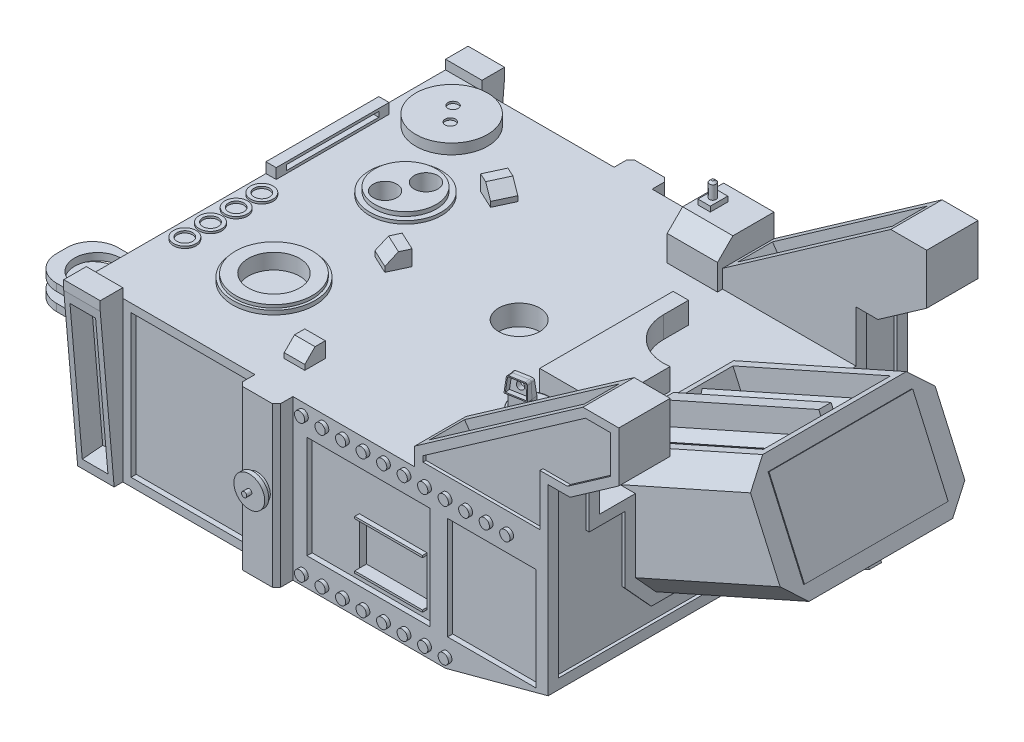
from build123d import *

# Parameters (mm, degrees)
SKETCH1_W                        = 450
SKETCH1_H                        = 155
BOSS_EXTRUDE1_DEPTH              = 175
SKETCH2_W                        = 35.55
SKETCH2_H                        = 164
BOSS_EXTRUDE2_DEPTH              = 22
SKETCH3_W                        = 37
SKETCH3_H                        = 155
BOSS_EXTRUDE3_DEPTH              = 16
CUT_EXTRUDE1_DEPTH               = 425.979117134
CUT_EXTRUDE2_DEPTH               = 35.55
CHAMFER1_SIZE                    = 4
SKETCH6_R                        = 12.5
BOSS_EXTRUDE4_DEPTH              = 4
SKETCH7_R                        = 15
BOSS_EXTRUDE5_DEPTH              = 4
SKETCH8_R                        = 2.5
BOSS_EXTRUDE6_DEPTH              = 5
SKETCH9_W                        = 120
SKETCH9_H                        = 100
SKETCH9_W_2                      = 112.725
SKETCH9_H_2                      = 139
SKETCH9_W_3                      = 86
CUT_EXTRUDE3_DEPTH               = 5
SKETCH10_W                       = 66
SKETCH10_H                       = 44
CUT_EXTRUDE4_DEPTH               = 7
SKETCH12_W                       = 66
SKETCH12_H                       = 2
BOSS_EXTRUDE7_DEPTH              = 4.5
SKETCH13_W                       = 25
SKETCH13_H                       = 138
CUT_EXTRUDE5_DEPTH               = 20
CHAMFER1_OF_MIRROR1_SIZE         = 4
SKETCH14_W                       = 105
SKETCH14_H                       = 120
CUT_EXTRUDE6_DEPTH               = 15
SKETCH15_R                       = 7.5
BOSS_EXTRUDE8_DEPTH              = 15
SKETCH16_R                       = 48.5
BOSS_EXTRUDE9_DEPTH              = 10
SKETCH17_R                       = 35
BOSS_EXTRUDE11_DEPTH             = 5
SKETCH18_W                       = 60
SKETCH18_H                       = 7
BOSS_EXTRUDE12_DEPTH             = 85
FILLET4_R                        = 25
SKETCH19_R                       = 22.5
CUT_EXTRUDE7_DEPTH               = 85
SKETCH20_W                       = 10
SKETCH20_H                       = 110
BOSS_EXTRUDE13_DEPTH             = 10
SKETCH21_W                       = 90
SKETCH21_H                       = 5
CUT_EXTRUDE8_DEPTH               = 10
SKETCH22_W                       = 95
SKETCH22_H                       = 32
CUT_EXTRUDE9_DEPTH               = 5
SKETCH23_R                       = 20
CUT_EXTRUDE10_DEPTH              = 20
BOSS_EXTRUDE14_DEPTH             = 90
CHAMFER3_SIZE                    = 20
SKETCH25_W                       = 168.155027328
SKETCH25_H                       = 124
CUT_EXTRUDE11_DEPTH              = 111
SKETCH26_R                       = 32.5
BOSS_EXTRUDE15_DEPTH             = 168.155027328
SKETCH27_W                       = 168.155027328
SKETCH27_H                       = 12
BOSS_EXTRUDE17_DEPTH             = 5
BOSS_EXTRUDE17_DIRECTION_2_REACH = 454.768
CIRPATTERN1_COUNT                = 10
SKETCH28_W                       = 140
SKETCH28_H                       = 85
BOSS_EXTRUDE18_DEPTH             = 1
SKETCH29_R                       = 5
BOSS_EXTRUDE19_DEPTH             = 3.5
SKETCH30_R                       = 5.5
BOSS_EXTRUDE20_DEPTH             = 2.5
BOSS_EXTRUDE21_DEPTH             = 50
SKETCH32_W                       = 184
SKETCH32_H                       = 34
CUT_EXTRUDE12_DEPTH              = 25
CUT_EXTRUDE13_DEPTH              = 3
CUT_EXTRUDE14_DEPTH              = 3
SKETCH35_R                       = 35
BOSS_EXTRUDE22_DEPTH             = 10
SKETCH36_R                       = 5
CUT_EXTRUDE15_DEPTH              = 2
SKETCH37_W                       = 49
SKETCH37_H                       = 55
BOSS_EXTRUDE23_DEPTH             = 40
CHAMFER4_SIZE                    = 15
SKETCH38_W                       = 12
SKETCH38_H                       = 17
BOSS_EXTRUDE24_DEPTH             = 5
SKETCH39_R                       = 3.25
BOSS_EXTRUDE25_DEPTH             = 15
CHAMFER5_SIZE                    = 2
BOSS_EXTRUDE26_DEPTH             = 21
SKETCH42_R                       = 20
BOSS_EXTRUDE27_DEPTH             = 3
BOSS_EXTRUDE28_DEPTH             = 6
CUT_EXTRUDE17_DEPTH              = 4
SKETCH45_R                       = 12.5
BOSS_EXTRUDE29_DEPTH             = 20
SKETCH46_R                       = 18
BOSS_EXTRUDE30_DEPTH             = 5
BOSS_EXTRUDE31_DEPTH             = 15
BOSS_EXTRUDE32_DEPTH             = 15
BOSS_EXTRUDE32_TAPER             = 5
SKETCH49_R                       = 3.5
CUT_EXTRUDE18_DEPTH              = 15
CHAMFER6_SIZE                    = 2
FILLET5_R                        = 2
FILLET6_R                        = 2
BOSS_EXTRUDE33_DEPTH             = 5
SKETCH51_R                       = 11
SKETCH51_R_2                     = 7.5
BOSS_EXTRUDE34_DEPTH             = 2
LPATTERN1_COUNT                  = 4
LPATTERN1_PITCH                  = 25
SKETCH52_R                       = 35
BOSS_EXTRUDE35_DEPTH             = 3
SKETCH53_R                       = 30
BOSS_EXTRUDE36_DEPTH             = 4
CUT_EXTRUDE21_START              = -13
SKETCH54_R                       = 11.5
CUT_EXTRUDE21_DEPTH              = 20
BOSS_EXTRUDE37_DEPTH             = 15
CHAMFER7_SIZE                    = 10
SKETCH56_R                       = 4
CUT_EXTRUDE22_DEPTH              = 2
SKETCH57_R                       = 4
CUT_EXTRUDE23_DEPTH              = 2
SKETCH58_R                       = 40
BOSS_EXTRUDE38_DEPTH             = 4
SKETCH59_R                       = 37.5
BOSS_EXTRUDE39_DEPTH             = 3
SKETCH60_R                       = 25
CUT_EXTRUDE24_DEPTH              = 15
SKETCH61_W                       = 20
SKETCH61_H                       = 20
BOSS_EXTRUDE40_DEPTH             = 15
CHAMFER8_SIZE                    = 10
SKETCH62_R                       = 5
CUT_EXTRUDE25_DEPTH              = 10


with BuildPart() as part:
    # Sketch1 → Boss-Extrude1 (new, symmetric)
    with BuildSketch(Plane.XY):
        Rectangle(SKETCH1_W, SKETCH1_H)
    extrude(amount=BOSS_EXTRUDE1_DEPTH, both=True)

    # Sketch2 → Boss-Extrude2 (add)
    with BuildSketch(Plane.XY.offset(175)):
        with Locations((-207.225, 4.5)):
            Rectangle(SKETCH2_W, SKETCH2_H)
    boss_extrude2 = extrude(amount=BOSS_EXTRUDE2_DEPTH)

    # Sketch3 → Boss-Extrude3 (add)
    with BuildSketch(Plane.XY.offset(175)):
        with Locations((-42.225, 0)):
            Rectangle(SKETCH3_W, SKETCH3_H)
    boss_extrude3 = extrude(amount=BOSS_EXTRUDE3_DEPTH)

    # Sketch4 → Cut-Extrude1 (cut, through all)
    with BuildSketch(Plane.XY.offset(175)):
        Polygon((125, -77.5), (225, -50.705080757), (225, -77.5), align=None)
    extrude(amount=-CUT_EXTRUDE1_DEPTH, mode=Mode.SUBTRACT)

    # Sketch5 → Cut-Extrude2 (cut)
    with BuildSketch(Plane.ZY.offset(225)):
        Polygon((197, 77.5), (183.439257153, -77.5), (197, -77.5), align=None)
    cut_extrude2 = extrude(amount=-CUT_EXTRUDE2_DEPTH, mode=Mode.SUBTRACT)

    # Chamfer1
    chamfer1_edges = [part.edges().sort_by_distance(p)[0] for p in [
        (-60.725, 0, 191),
        (-23.725, 0, 191),
    ]]
    chamfer(chamfer1_edges, length=CHAMFER1_SIZE)

    # Sketch6 → Boss-Extrude4 (add)
    with BuildSketch(Plane.XY.offset(191)):
        with Locations((-42.225, 0)):
            Circle(SKETCH6_R)
    boss_extrude4 = extrude(amount=BOSS_EXTRUDE4_DEPTH)

    # Sketch7 → Boss-Extrude5 (add)
    with BuildSketch(Plane.XY.offset(195)):
        with Locations((-42.225, 0)):
            Circle(SKETCH7_R)
    boss_extrude5 = extrude(amount=BOSS_EXTRUDE5_DEPTH)

    # Sketch8 → Boss-Extrude6 (add)
    with BuildSketch(Plane.XY.offset(199)):
        with Locations((-42.225, 0)):
            Circle(SKETCH8_R)
    boss_extrude6 = extrude(amount=BOSS_EXTRUDE6_DEPTH)

    # Sketch9 → Cut-Extrude3 (cut)
    with BuildSketch(Plane.XY.offset(175)):
        with Locations((50, 0)):
            Rectangle(SKETCH9_W, SKETCH9_H)
        with Locations((-125.0875, 0)):
            Rectangle(SKETCH9_W_2, SKETCH9_H_2)
        with Locations((170, 0)):
            Rectangle(SKETCH9_W_3, SKETCH9_H)
    cut_extrude3 = extrude(amount=-CUT_EXTRUDE3_DEPTH, mode=Mode.SUBTRACT)

    # Sketch10 → Cut-Extrude4 (cut)
    with BuildSketch(Plane.XY.offset(170)):
        with Locations((69, -18)):
            Rectangle(SKETCH10_W, SKETCH10_H)
    cut_extrude4 = extrude(amount=-CUT_EXTRUDE4_DEPTH, mode=Mode.SUBTRACT)

    # Sketch12 → Boss-Extrude7 (add)
    with BuildSketch(Plane.XY.offset(170)):
        with Locations((69, 5)):
            Rectangle(SKETCH12_W, SKETCH12_H)
        with Locations((69, -41)):
            Rectangle(SKETCH12_W, SKETCH12_H)
    boss_extrude7 = extrude(amount=BOSS_EXTRUDE7_DEPTH)

    # Sketch13 → Cut-Extrude5 (cut)
    with BuildSketch(Plane(origin=(0, -16.515645929, 188.774696787), x_dir=(1, 0, 0), z_dir=(0, -0.08715574274765135, 0.9961946980917462))):
        with Locations((-207.225, 16.578733014)):
            Rectangle(SKETCH13_W, SKETCH13_H)
    cut_extrude5 = extrude(amount=-CUT_EXTRUDE5_DEPTH, mode=Mode.SUBTRACT)

    # Mirror1: Boss-Extrude2, Boss-Extrude3, Cut-Extrude2, Boss-Extrude4, Boss-Extrude5, Boss-Extrude6, Cut-Extrude3, Cut-Extrude4, Boss-Extrude7, Cut-Extrude5 across plane
    add(boss_extrude2.mirror(Plane.XY))
    add(boss_extrude3.mirror(Plane.XY))
    add(cut_extrude2.mirror(Plane.XY), mode=Mode.SUBTRACT)
    add(boss_extrude4.mirror(Plane.XY))
    add(boss_extrude5.mirror(Plane.XY))
    add(boss_extrude6.mirror(Plane.XY))
    add(cut_extrude3.mirror(Plane.XY), mode=Mode.SUBTRACT)
    add(cut_extrude4.mirror(Plane.XY), mode=Mode.SUBTRACT)
    add(boss_extrude7.mirror(Plane.XY))
    add(cut_extrude5.mirror(Plane.XY), mode=Mode.SUBTRACT)

    # Chamfer1 of Mirror1
    chamfer1_of_mirror1_edges = [part.edges().sort_by_distance(p)[0] for p in [
        (-60.725, 0, -191),
        (-23.725, 0, -191),
    ]]
    chamfer(chamfer1_of_mirror1_edges, length=CHAMFER1_OF_MIRROR1_SIZE)

    # Sketch14 → Cut-Extrude6 (cut)
    with BuildSketch(Plane.ZY.offset(225)):
        with Locations((-117.5, 0)):
            Rectangle(SKETCH14_W, SKETCH14_H)
    extrude(amount=-CUT_EXTRUDE6_DEPTH, mode=Mode.SUBTRACT)

    # Sketch15 → Boss-Extrude8 (add)
    with BuildSketch(Plane.ZY.offset(210)):
        with Locations(Location((-143, -5, 0), (0, 0, 180))):
            Circle(SKETCH15_R)
    extrude(amount=BOSS_EXTRUDE8_DEPTH)

    # Sketch16 → Boss-Extrude9 (add)
    with BuildSketch(Plane.ZY.offset(225)):
        with Locations(Location((99, 0, 0), (0, 0, 90))):
            Circle(SKETCH16_R)
    extrude(amount=BOSS_EXTRUDE9_DEPTH)

    # Sketch17 → Boss-Extrude11 (add)
    with BuildSketch(Plane.ZY.offset(235)):
        with Locations(Location((99, 0, 0), (0, 0, 270))):
            Circle(SKETCH17_R)
    extrude(amount=BOSS_EXTRUDE11_DEPTH)

    # Sketch18 → Boss-Extrude12 (add)
    with BuildSketch(Plane.ZY.offset(240)):
        with Locations((99, 8.5)):
            Rectangle(SKETCH18_W, SKETCH18_H)
        with Locations((99, -8.5)):
            Rectangle(SKETCH18_W, SKETCH18_H)
    extrude(amount=BOSS_EXTRUDE12_DEPTH)

    # Fillet4
    fillet4_edges = [part.edges().sort_by_distance(p)[0] for p in [
        (-325, 8.5, 69),
        (-325, 8.5, 129),
        (-325, -8.5, 129),
        (-325, -8.5, 69),
    ]]
    fillet(fillet4_edges, radius=FILLET4_R)

    # Sketch19 → Cut-Extrude7 (cut)
    with BuildSketch(Plane.XZ.offset(12)):
        with Locations((-290, 99)):
            Circle(SKETCH19_R)
    extrude(amount=-CUT_EXTRUDE7_DEPTH, mode=Mode.SUBTRACT)

    # Sketch20 → Boss-Extrude13 (add)
    with BuildSketch(Plane(origin=(0, 77.5, 0), x_dir=(1, 0, 0), z_dir=(0, 1, 0))):
        with Locations((-220, 55)):
            Rectangle(SKETCH20_W, SKETCH20_H)
    extrude(amount=BOSS_EXTRUDE13_DEPTH)

    # Sketch21 → Cut-Extrude8 (cut)
    with BuildSketch(Plane.ZY.offset(225)):
        with Locations((-55, 82.5)):
            Rectangle(SKETCH21_W, SKETCH21_H)
    extrude(amount=-CUT_EXTRUDE8_DEPTH, mode=Mode.SUBTRACT)

    # Sketch22 → Cut-Extrude9 (cut)
    with BuildSketch(Plane.ZY.offset(225)):
        with Locations((0, -15.1)):
            Rectangle(SKETCH22_W, SKETCH22_H)
    extrude(amount=-CUT_EXTRUDE9_DEPTH, mode=Mode.SUBTRACT)

    # Sketch23 → Cut-Extrude10 (cut)
    with BuildSketch(Plane(origin=(0, 77.5, 0), x_dir=(1, 0, 0), z_dir=(0, 1, 0))):
        with Locations(Location((21.775, 0, 0), (0, 0, 180))):
            Circle(SKETCH23_R)
    extrude(amount=-CUT_EXTRUDE10_DEPTH, mode=Mode.SUBTRACT)

    # Sketch24 → Boss-Extrude14 (add, symmetric)
    with BuildSketch(Plane.XY):
        Polygon((99, 50), (144.147767381, -51.403545798), (374.147767381, 50.999051823), (329, 152.402597621), align=None)
    extrude(amount=BOSS_EXTRUDE14_DEPTH, both=True)

    # Chamfer3
    chamfer3_edges = [part.edges().sort_by_distance(p)[0] for p in [
        (244.883005641, 114.95129881, -90),
        (299.573883691, 17.796619629, -90),
        (299.573883691, 17.796619629, 90),
        (244.883005641, 114.95129881, 90),
    ]]
    chamfer(chamfer3_edges, length=CHAMFER3_SIZE)

    # Sketch25 → Cut-Extrude11 (cut)
    with BuildSketch(Plane(origin=(-2.200585652, 4.942596298, 0), x_dir=(0.9135454576426033, 0.4067366430757949, 0), z_dir=(-0.4067366430757949, 0.9135454576426033, 0))):
        with Locations((270.466662853, 0)):
            Rectangle(SKETCH25_W, SKETCH25_H)
    extrude(amount=-CUT_EXTRUDE11_DEPTH, mode=Mode.SUBTRACT)

    # Sketch26 → Boss-Extrude15 (add)
    with BuildSketch(Plane(origin=(170.274960595, 75.811296847, 0), x_dir=(0, 0, -1), z_dir=(0.9135454576426033, 0.4067366430757949, 0))):
        with Locations(Location((0, -50.089654782, 0), (0, 0, 270))):
            Circle(SKETCH26_R)
    extrude(amount=BOSS_EXTRUDE15_DEPTH)

    # Sketch27 → Boss-Extrude17 (add)
    with BuildSketch(Plane(origin=(-2.200585652, 4.942596298, 0), x_dir=(0.9135454576426033, 0.4067366430757949, 0), z_dir=(-0.4067366430757949, 0.9135454576426033, 0))):
        with Locations((270.466662853, 0)):
            Rectangle(SKETCH27_W, SKETCH27_H)
    boss_extrude17 = extrude(amount=BOSS_EXTRUDE17_DEPTH)

    # Sketch27 → Boss-Extrude17 direction 2 (add, up to next)
    with BuildSketch(Plane(origin=(-2.200585652, 4.942596298, 0), x_dir=(0.9135454576426033, 0.4067366430757949, 0), z_dir=(-0.4067366430757949, 0.9135454576426033, 0)), mode=Mode.PRIVATE) as boss_extrude17_direction_2_sk1:
        with Locations((270.466662853, 0)):
            Rectangle(SKETCH27_W, SKETCH27_H)
    boss_extrude17_direction_2_tool1 = extrude(boss_extrude17_direction_2_sk1.sketch, amount=-BOSS_EXTRUDE17_DIRECTION_2_REACH, mode=Mode.PRIVATE) - part.part
    boss_extrude17_direction_2 = boss_extrude17_direction_2_tool1.solids().sort_by_distance((244.883006, 114.951299, 0))[0]
    add(boss_extrude17_direction_2)

    # CirPattern1: Boss-Extrude17, Boss-Extrude17 direction 2 ×10 about axis
    cirpattern1_axis = Axis((20.373298039, -45.759176601, 0), (0.9135454576426033, 0.40673664307579477, 0))
    add([boss_extrude17.rotate(cirpattern1_axis, i * 360 / CIRPATTERN1_COUNT) for i in range(1, CIRPATTERN1_COUNT)])
    add([boss_extrude17_direction_2.rotate(cirpattern1_axis, i * 360 / CIRPATTERN1_COUNT) for i in range(1, CIRPATTERN1_COUNT)])

    # Sketch28 → Boss-Extrude18 (add)
    with BuildSketch(Plane(origin=(331.200585652, 147.460001323, 0), x_dir=(0, 0, -1), z_dir=(0.9135454576426035, 0.4067366430757945, 0))):
        with Locations((0, -50.089654782)):
            Rectangle(SKETCH28_W, SKETCH28_H)
    extrude(amount=BOSS_EXTRUDE18_DEPTH)

    # Sketch29 → Boss-Extrude19 (add)
    with BuildSketch(Plane.XY.offset(175)):
        with Locations(Location((-13.725, 67, 0), (0, 0, 180))):
            Circle(SKETCH29_R)
        with Locations(Location((6.275, 67, 0), (0, 0, 180))):
            Circle(SKETCH29_R)
        with Locations(Location((26.275, 67, 0), (0, 0, 180))):
            Circle(SKETCH29_R)
        with Locations(Location((46.275, 67, 0), (0, 0, 180))):
            Circle(SKETCH29_R)
        with Locations(Location((66.275, 67, 0), (0, 0, 180))):
            Circle(SKETCH29_R)
        with Locations(Location((86.275, 67, 0), (0, 0, 180))):
            Circle(SKETCH29_R)
        with Locations(Location((106.275, 67, 0), (0, 0, 180))):
            Circle(SKETCH29_R)
        with Locations(Location((126.275, 67, 0), (0, 0, 180))):
            Circle(SKETCH29_R)
        with Locations(Location((146.275, 67, 0), (0, 0, 180))):
            Circle(SKETCH29_R)
        with Locations(Location((166.275, 67, 0), (0, 0, 180))):
            Circle(SKETCH29_R)
        with Locations(Location((186.275, 67, 0), (0, 0, 180))):
            Circle(SKETCH29_R)
        with Locations(Location((-13.725, -67, 0), (0, 0, 180))):
            Circle(SKETCH29_R)
        with Locations(Location((6.275, -67, 0), (0, 0, 180))):
            Circle(SKETCH29_R)
        with Locations(Location((26.275, -67, 0), (0, 0, 180))):
            Circle(SKETCH29_R)
        with Locations(Location((46.275, -67, 0), (0, 0, 180))):
            Circle(SKETCH29_R)
        with Locations(Location((66.275, -67, 0), (0, 0, 180))):
            Circle(SKETCH29_R)
        with Locations(Location((86.275, -67, 0), (0, 0, 180))):
            Circle(SKETCH29_R)
        with Locations(Location((106.275, -67, 0), (0, 0, 180))):
            Circle(SKETCH29_R)
        with Locations(Location((126.275, -67, 0), (0, 0, 180))):
            Circle(SKETCH29_R)
    boss_extrude19 = extrude(amount=BOSS_EXTRUDE19_DEPTH)

    # Mirror2: Boss-Extrude19 across plane
    add(boss_extrude19.mirror(Plane.XY))

    # Sketch30 → Boss-Extrude20 (add)
    with BuildSketch(Plane.ZY.offset(225)):
        with Locations(Location((175.4, 62.5, 0), (0, 0, 90))):
            Circle(SKETCH30_R)
        with Locations(Location((157.4, 62.5, 0), (0, 0, 90))):
            Circle(SKETCH30_R)
        with Locations(Location((139.4, 62.5, 0), (0, 0, 90))):
            Circle(SKETCH30_R)
        with Locations(Location((121.4, 62.5, 0), (0, 0, 90))):
            Circle(SKETCH30_R)
        with Locations(Location((103.4, 62.5, 0), (0, 0, 90))):
            Circle(SKETCH30_R)
        with Locations(Location((85.4, 62.5, 0), (0, 0, 90))):
            Circle(SKETCH30_R)
        with Locations(Location((67.4, 62.5, 0), (0, 0, 90))):
            Circle(SKETCH30_R)
        with Locations(Location((49.4, 62.5, 0), (0, 0, 90))):
            Circle(SKETCH30_R)
        with Locations(Location((31.4, 62.5, 0), (0, 0, 90))):
            Circle(SKETCH30_R)
        with Locations(Location((13.4, 62.5, 0), (0, 0, 90))):
            Circle(SKETCH30_R)
        with Locations(Location((-4.6, 62.5, 0), (0, 0, 90))):
            Circle(SKETCH30_R)
        with Locations(Location((-22.6, 62.5, 0), (0, 0, 90))):
            Circle(SKETCH30_R)
        with Locations(Location((-40.6, 62.5, 0), (0, 0, 90))):
            Circle(SKETCH30_R)
    extrude(amount=BOSS_EXTRUDE20_DEPTH)

    # Sketch31 → Boss-Extrude21 (add)
    with BuildSketch(Plane.XY.offset(175)):
        Polygon((225, 77.5), (95, 77.5), (95, 95.052146038), (258.830408858, 209.767433308), (293.830408858, 209.767433308), (293.830408858, 160.767433308), (246.319590289, 127.5), (225, 127.5), align=None)
    boss_extrude21 = extrude(amount=-BOSS_EXTRUDE21_DEPTH)

    # Sketch32 → Cut-Extrude12 (cut)
    with BuildSketch(Plane(origin=(-13.405856919, 19.145547837, 0), x_dir=(0.819152044288991, 0.5735764363510472, 0), z_dir=(-0.5735764363510472, 0.819152044288991, 0))):
        with Locations((232.3391154, -150)):
            Rectangle(SKETCH32_W, SKETCH32_H)
    cut_extrude12 = extrude(amount=-CUT_EXTRUDE12_DEPTH, mode=Mode.SUBTRACT)

    # Sketch33 → Cut-Extrude13 (cut)
    with BuildSketch(Plane.XY.offset(175)):
        Polygon((103, 90.887609634), (261.352799169, 201.767433308), (285.830408858, 201.767433308), (285.830408858, 164.931969713), (243.797199978, 135.5), (217, 135.5), (217, 85.5), (103, 85.5), align=None)
    cut_extrude13 = extrude(amount=-CUT_EXTRUDE13_DEPTH, mode=Mode.SUBTRACT)

    # Mirror3: Boss-Extrude21, Cut-Extrude12, Cut-Extrude13 across plane
    add(boss_extrude21.mirror(Plane.XY))
    add(cut_extrude12.mirror(Plane.XY), mode=Mode.SUBTRACT)
    add(cut_extrude13.mirror(Plane.XY), mode=Mode.SUBTRACT)

    # Sketch34 → Cut-Extrude14 (cut)
    with BuildSketch(Plane(origin=(225, 0, 0), x_dir=(0, 0, -1), z_dir=(1, 0, 0))):
        Polygon((16, -30.878993958), (-16, -30.878993958), (-16, -25.405812565), (-62, -25.405812565), (-74.409158017, -25.405812565), (-100, 2.606851466), (-100, 67.5), (-135, 67.5), (-135, 117.5), (-165, 117.5), (-165, -40.705080757), (165, -40.705080757), (165, 117.5), (135, 117.5), (135, 67.5), (100, 67.5), (100, 2.606851466), (74.409158017, -25.405812565), (62, -25.405812565), (16, -25.405812565), align=None)
    extrude(amount=-CUT_EXTRUDE14_DEPTH, mode=Mode.SUBTRACT)

    # Sketch35 → Boss-Extrude22 (add)
    with BuildSketch(Plane(origin=(0, 77.5, 0), x_dir=(1, 0, 0), z_dir=(0, 1, 0))):
        with Locations((-175, 131)):
            Circle(SKETCH35_R)
    extrude(amount=BOSS_EXTRUDE22_DEPTH)

    # Sketch36 → Cut-Extrude15 (cut)
    with BuildSketch(Plane(origin=(0, 87.5, 0), x_dir=(1, 0, 0), z_dir=(0, 1, 0))):
        with Locations(Location((-181.33, 138.66, 0), (0, 0, 180))):
            Circle(SKETCH36_R)
        with Locations(Location((-168.67, 123.34, 0), (0, 0, 180))):
            Circle(SKETCH36_R)
    extrude(amount=-CUT_EXTRUDE15_DEPTH, mode=Mode.SUBTRACT)

    # Sketch37 → Boss-Extrude23 (add)
    with BuildSketch(Plane(origin=(0, 77.5, 0), x_dir=(1, 0, 0), z_dir=(0, 1, 0))):
        with Locations((70.5, 147.5)):
            Rectangle(SKETCH37_W, SKETCH37_H)
    extrude(amount=BOSS_EXTRUDE23_DEPTH)

    # Chamfer4
    chamfer4_edges = [part.edges().sort_by_distance(p)[0] for p in [
        (70.5, 117.5, -120),
    ]]
    chamfer(chamfer4_edges, length=CHAMFER4_SIZE)

    # Sketch38 → Boss-Extrude24 (add)
    with BuildSketch(Plane(origin=(0, 117.5, 0), x_dir=(1, 0, 0), z_dir=(0, 1, 0))):
        with Locations((58, 152.5)):
            Rectangle(SKETCH38_W, SKETCH38_H)
    extrude(amount=BOSS_EXTRUDE24_DEPTH)

    # Sketch39 → Boss-Extrude25 (add)
    with BuildSketch(Plane(origin=(0, 122.5, 0), x_dir=(1, 0, 0), z_dir=(0, 1, 0))):
        with Locations(Location((58, 152.5, 0), (0, 0, 270))):
            Circle(SKETCH39_R)
    extrude(amount=BOSS_EXTRUDE25_DEPTH)

    # Chamfer5
    chamfer5_edges = [part.edges().sort_by_distance(p)[0] for p in [
        (58, 137.5, -155.75),
    ]]
    chamfer(chamfer5_edges, length=CHAMFER5_SIZE)

    # Sketch40 → Boss-Extrude26 (add)
    with BuildSketch(Plane(origin=(0, 77.5, 0), x_dir=(1, 0, 0), z_dir=(0, 1, 0))):
        with BuildLine():
            Line((155.766011282, -52), (93.766011282, -52))
            Line((93.766011282, -52), (93.766011282, 78))
            Line((93.766011282, 78), (108.766011282, 78))
            Line((108.766011282, 78), (108.766011282, 53.851878782))
            ThreePointArc((108.766011282, 53.851878782), (122.956687096, 22.715581635), (155.766011282, 13))
            Line((155.766011282, 13), (155.766011282, -52))
        make_face()
    extrude(amount=BOSS_EXTRUDE26_DEPTH)

    # Sketch42 → Boss-Extrude27 (add)
    with BuildSketch(Plane(origin=(0, 77.5, 0), x_dir=(1, 0, 0), z_dir=(0, 1, 0))):
        with Locations((130, -97)):
            Circle(SKETCH42_R)
    extrude(amount=BOSS_EXTRUDE27_DEPTH)

    # Sketch43 → Boss-Extrude28 (add)
    with BuildSketch(Plane(origin=(0, 80.5, 0), x_dir=(1, 0, 0), z_dir=(0, 1, 0))):
        Polygon((130, -70.730562752), (107.25, -83.865281376), (107.25, -110.134718624), (130, -123.269437248), (152.75, -110.134718624), (152.75, -83.865281376), align=None)
    extrude(amount=BOSS_EXTRUDE28_DEPTH)

    # Sketch44 → Cut-Extrude17 (cut)
    with BuildSketch(Plane(origin=(0, 86.5, 0), x_dir=(1, 0, 0), z_dir=(0, 1, 0))):
        Polygon((149.75, -85.597332184), (130, -74.194664367), (110.25, -85.597332184), (110.25, -108.402667816), (130, -119.805335633), (149.75, -108.402667816), align=None)
    extrude(amount=-CUT_EXTRUDE17_DEPTH, mode=Mode.SUBTRACT)

    # Sketch45 → Boss-Extrude29 (add)
    with BuildSketch(Plane(origin=(0, 82.5, 0), x_dir=(1, 0, 0), z_dir=(0, 1, 0))):
        with Locations(Location((130, -97, 0), (0, 0, 270))):
            Circle(SKETCH45_R)
    extrude(amount=BOSS_EXTRUDE29_DEPTH)

    # Sketch46 → Boss-Extrude30 (add)
    with BuildSketch(Plane(origin=(0, 102.5, 0), x_dir=(1, 0, 0), z_dir=(0, 1, 0))):
        with Locations(Location((130, -97, 0), (0, 0, 270))):
            Circle(SKETCH46_R)
    extrude(amount=BOSS_EXTRUDE30_DEPTH)

    # Sketch47 → Boss-Extrude31 (add)
    with BuildSketch(Plane(origin=(0, 107.5, 0), x_dir=(1, 0, 0), z_dir=(0, 1, 0))):
        Polygon((119.630977937, -103.782058518), (139.327132997, -100.309094964), (140.369022063, -106.217941482), (120.672867003, -109.690905036), align=None)
    extrude(amount=BOSS_EXTRUDE31_DEPTH)

    # Sketch48 → Boss-Extrude32 (add)
    with BuildSketch(Plane(origin=(0, 122.5, 0), x_dir=(1, 0, 0), z_dir=(0, 1, 0))):
        Polygon((119.630977937, -103.782058518), (120.672867003, -109.690905036), (140.369022063, -106.217941482), (139.327132997, -100.309094964), align=None)
    extrude(amount=BOSS_EXTRUDE32_DEPTH, taper=BOSS_EXTRUDE32_TAPER)

    # Sketch49 → Cut-Extrude18 (cut)
    with BuildSketch(Plane(origin=(24.073764956, 12.129015981, 136.529105525), x_dir=(0.984924038463376, -0.015307621922849051, -0.17230877855774332), z_dir=(0.17298739392509016, 0.08715574274765839, 0.9810602621904069))):
        with Locations(Location((107.960851367, 119.994335858, 0), (0, 0, 0.880447016))):
            Circle(SKETCH49_R)
    extrude(amount=-CUT_EXTRUDE18_DEPTH, mode=Mode.SUBTRACT)

    # Chamfer6
    chamfer6_edges = [part.edges().sort_by_distance(p)[0] for p in [
        (149.75, 86.5, 97),
        (139.875, 86.5, 79.895998275),
        (120.125, 86.5, 79.895998275),
        (110.25, 86.5, 97),
        (120.125, 86.5, 114.104001725),
        (139.875, 86.5, 114.104001725),
    ]]
    chamfer(chamfer6_edges, length=CHAMFER6_SIZE)

    # Fillet5
    fillet5_edges = [part.edges().sort_by_distance(p)[0] for p in [
        (130, 102.5, 79),
        (130, 107.5, 79),
    ]]
    fillet(fillet5_edges, radius=FILLET5_R)

    # Fillet6
    fillet6_edges = [part.edges().sort_by_distance(p)[0] for p in [
        (121.444315182, 137.5, 106.508598072),
        (138.555684818, 137.5, 103.491401928),
    ]]
    fillet(fillet6_edges, radius=FILLET6_R)

    # Sketch50 → Boss-Extrude33 (add)
    with BuildSketch(Plane(origin=(24.073764956, 12.129015981, 136.529105525), x_dir=(0.984924038463376, -0.015307621922849091, -0.17230877855774376), z_dir=(0.1729873939250906, 0.08715574274765837, 0.9810602621904068))):
        with BuildLine():
            Line((118.075356642, 112.620236895), (116.719678825, 125.825599733))
            add(Edge.make_bspline(
                [(116.719678825, 125.825599733), (116.531809772, 127.655591326), (114.699363798, 127.627430463)],
                knots=[4.799655443, 4.799655443, 4.799655443, 6.283185307, 6.283185307, 6.283185307], degree=2, weights=[1, 0.737277337, 1]))
            Line((114.699363798, 127.627430463), (100.990967078, 127.41676107))
            add(Edge.make_bspline(
                [(100.990967078, 127.41676107), (99.158521104, 127.388600207), (99.026973777, 125.553699852)],
                knots=[0, 0, 0, 1.483529864, 1.483529864, 1.483529864], degree=2, weights=[1, 0.737277337, 1]))
            Line((99.026973777, 125.553699852), (98.07771795, 112.312915004))
            Line((98.07771795, 112.312915004), (118.075356642, 112.620236895))
        make_face()
        with BuildLine():
            Line((116.969172732, 113.603355241), (115.72490719, 125.723475327))
            add(Edge.make_bspline(
                [(115.72490719, 125.723475327), (115.712127077, 125.847963624), (115.676962121, 125.967393513), (115.564258153, 126.189562613), (115.487954457, 126.289086781), (115.211035007, 126.537900622), (114.965040115, 126.631395273), (114.714729893, 126.627548529)],
                knots=[0, 0, 0, 0, 0.25, 0.25, 0.5, 0.5, 1, 1, 1, 1], degree=3))
            Line((114.714729893, 126.627548529), (101.006333173, 126.416879136))
            add(Edge.make_bspline(
                [(101.006333173, 126.416879136), (100.881203527, 126.414956155), (100.759091369, 126.389697155), (100.528878945, 126.295086843), (100.423566225, 126.226459059), (100.154649439, 125.969709782), (100.042307768, 125.731787515), (100.024413784, 125.482191573)],
                knots=[0, 0, 0, 0, 0.25, 0.25, 0.5, 0.5, 1, 1, 1, 1], degree=3))
            Line((100.024413784, 125.482191573), (99.153169672, 113.329560527))
            Line((99.153169672, 113.329560527), (116.969172732, 113.603355241))
        make_face(mode=Mode.SUBTRACT)
    extrude(amount=BOSS_EXTRUDE33_DEPTH)

    # Sketch51 → Boss-Extrude34 (add)
    with BuildSketch(Plane(origin=(0, 77.5, 0), x_dir=(1, 0, 0), z_dir=(0, 1, 0))):
        with Locations((-209, -20)):
            Circle(SKETCH51_R)
        with Locations(Location((-209, -20, 0), (0, 0, 180))):
            Circle(SKETCH51_R_2, mode=Mode.SUBTRACT)
    boss_extrude34 = extrude(amount=BOSS_EXTRUDE34_DEPTH)

    # LPattern1: Boss-Extrude34 ×4
    with Locations(*[(0, 0, i * LPATTERN1_PITCH) for i in range(1, LPATTERN1_COUNT)]):
        add(boss_extrude34)

    # Sketch52 → Boss-Extrude35 (add)
    with BuildSketch(Plane(origin=(0, 77.5, 0), x_dir=(1, 0, 0), z_dir=(0, 1, 0))):
        with Locations((-139, 50)):
            Circle(SKETCH52_R)
    extrude(amount=BOSS_EXTRUDE35_DEPTH)

    # Sketch53 → Boss-Extrude36 (add)
    with BuildSketch(Plane(origin=(0, 80.5, 0), x_dir=(1, 0, 0), z_dir=(0, 1, 0))):
        with Locations(Location((-139, 50, 0), (0, 0, 180))):
            Circle(SKETCH53_R)
    extrude(amount=BOSS_EXTRUDE36_DEPTH)

    # Sketch54 → Cut-Extrude21 (cut)
    with BuildSketch(Plane(origin=(0, 77.5, 0), x_dir=(1, 0, 0), z_dir=(0, 1, 0)).offset(CUT_EXTRUDE21_START)):
        with Locations(Location((-145.339273926, 36.405383194, 0), (0, 0, 180))):
            Circle(SKETCH54_R)
        with Locations(Location((-132.660726074, 63.594616806, 0), (0, 0, 180))):
            Circle(SKETCH54_R)
    extrude(amount=CUT_EXTRUDE21_DEPTH, mode=Mode.SUBTRACT)

    # Sketch55 → Boss-Extrude37 (add)
    with BuildSketch(Plane(origin=(0, 77.5, 0), x_dir=(1, 0, 0), z_dir=(0, 1, 0))):
        Polygon((-93.374373747, 1.139973096), (-101.826738982, -16.986182645), (-83.700583241, -25.438547879), (-75.248218007, -7.312392139), align=None)
        Polygon((-105.180777894, 89.398733687), (-96.72841266, 107.524889428), (-78.602256919, 99.072524193), (-87.054622154, 80.946368453), align=None)
    extrude(amount=BOSS_EXTRUDE37_DEPTH)

    # Chamfer7
    chamfer7_edges = [part.edges().sort_by_distance(p)[0] for p in [
        (-92.763661112, 92.5, 21.212365262),
        (-82.828439536, 92.5, -90.009446323),
    ]]
    chamfer(chamfer7_edges, length=CHAMFER7_SIZE)

    # Sketch56 → Cut-Extrude22 (cut)
    with BuildSketch(Plane(origin=(-120.636540933, 0, -56.25374289), x_dir=(-0.4226182617407, 0, 0.9063077870366497), z_dir=(-0.9063077870366497, 0, -0.4226182617407))):
        with Locations((-46.57145097, 84.5)):
            Circle(SKETCH56_R)
    extrude(amount=-CUT_EXTRUDE22_DEPTH, mode=Mode.SUBTRACT)

    # Sketch57 → Cut-Extrude23 (cut)
    with BuildSketch(Plane(origin=(-16.240606592, 0, 34.828093231), x_dir=(-0.9063077870366498, 0, -0.42261826174069994), z_dir=(0.4226182617406999, 0, -0.9063077870366497))):
        with Locations((75.107695485, 84.5)):
            Circle(SKETCH57_R)
    extrude(amount=-CUT_EXTRUDE23_DEPTH, mode=Mode.SUBTRACT)

    # Sketch58 → Boss-Extrude38 (add)
    with BuildSketch(Plane(origin=(0, 77.5, 0), x_dir=(1, 0, 0), z_dir=(0, 1, 0))):
        with Locations((-130, -87.149287392)):
            Circle(SKETCH58_R)
    extrude(amount=BOSS_EXTRUDE38_DEPTH)

    # Sketch59 → Boss-Extrude39 (add)
    with BuildSketch(Plane(origin=(0, 81.5, 0), x_dir=(1, 0, 0), z_dir=(0, 1, 0))):
        with Locations(Location((-130, -87.149287392, 0), (0, 0, 180))):
            Circle(SKETCH59_R)
    extrude(amount=BOSS_EXTRUDE39_DEPTH)

    # Sketch60 → Cut-Extrude24 (cut)
    with BuildSketch(Plane(origin=(0, 84.5, 0), x_dir=(1, 0, 0), z_dir=(0, 1, 0))):
        with Locations(Location((-130, -87.149287392, 0), (0, 0, 180))):
            Circle(SKETCH60_R)
    extrude(amount=-CUT_EXTRUDE24_DEPTH, mode=Mode.SUBTRACT)

    # Sketch61 → Boss-Extrude40 (add)
    with BuildSketch(Plane(origin=(0, 77.5, 0), x_dir=(1, 0, 0), z_dir=(0, 1, 0))):
        with Locations((-50, -137.149287392)):
            Rectangle(SKETCH61_W, SKETCH61_H)
    extrude(amount=BOSS_EXTRUDE40_DEPTH)

    # Chamfer8
    chamfer8_edges = [part.edges().sort_by_distance(p)[0] for p in [
        (-50, 92.5, 147.149287392),
    ]]
    chamfer(chamfer8_edges, length=CHAMFER8_SIZE)

    # Sketch62 → Cut-Extrude25 (cut)
    with BuildSketch(Plane(origin=(0, 0, 127.149287392), x_dir=(-1, 0, 0), z_dir=(0, 0, -1))):
        with Locations((50, 85)):
            Circle(SKETCH62_R)
    extrude(amount=-CUT_EXTRUDE25_DEPTH, mode=Mode.SUBTRACT)


solid = part.part
